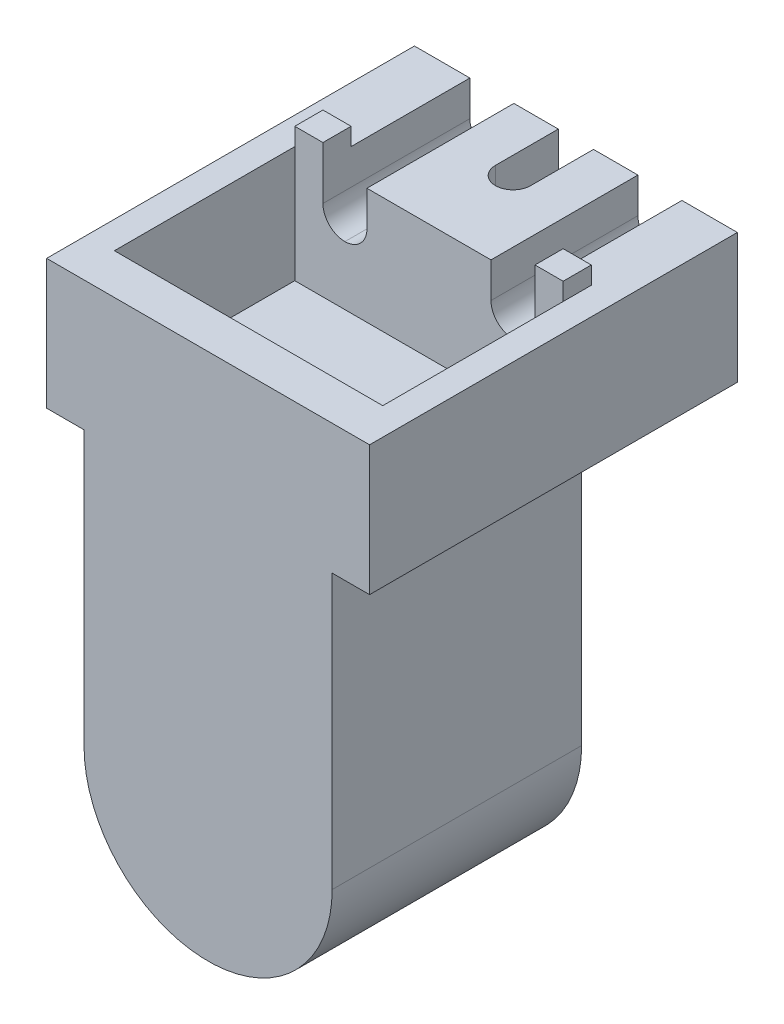
from build123d import *

# Parameters (mm, degrees)
RESSALTO_EXTRUS_O1_DEPTH = 28.35
ESBO_O2_R                = 4.25
CORTE_EXTRUS_O1_DEPTH    = 26
ESBO_O3_W                = 36.7
ESBO_O3_H                = 41.8
RESSALTO_EXTRUS_O2_DEPTH = 14.75
ESBO_O5_W                = 30.5
ESBO_O5_H                = 20.5
CORTE_EXTRUS_O2_DEPTH    = 13.2
CORTE_EXTRUS_O3_DEPTH    = 69.850889609
ESBO_O7_W                = 5
ESBO_O7_H                = 16.7
CORTE_EXTRUS_O4_DEPTH    = 6.5
FILETE1_R                = 2.5
ESBO_O8_W                = 8.5
ESBO_O8_H                = 3.5
CORTE_EXTRUS_O5_DEPTH    = 14
ESBO_O9_W                = 3.2
ESBO_O9_H                = 3.2
RESSALTO_EXTRUS_O3_DEPTH = 2


with BuildPart() as part:
    # Esboço1 → Ressalto-extrusão1 (new body)
    with BuildSketch(Plane.XY):
        with BuildLine():
            Line((14.1, -8.525), (14.1, 22.625))
            Line((14.1, 22.625), (-14.1, 22.625))
            Line((-14.1, 22.625), (-14.1, -8.525))
            ThreePointArc((-14.1, -8.525), (0, -22.625), (14.1, -8.525))
        make_face()
    extrude(amount=RESSALTO_EXTRUS_O1_DEPTH)

    # Esboço2 → Corte-extrusão1 (cut)
    with BuildSketch(Plane(origin=(0, 0, 0), x_dir=(-1, 0, 0), z_dir=(0, 0, -1))):
        with Locations((0, -13.375)):
            Circle(ESBO_O2_R)
    extrude(amount=-CORTE_EXTRUS_O1_DEPTH, mode=Mode.SUBTRACT)

    # Esboço3 → Ressalto-extrusão2 (add)
    with BuildSketch(Plane(origin=(0, 22.625, 0), x_dir=(1, 0, 0), z_dir=(0, 1, 0))):
        with Locations((0, -7.45)):
            Rectangle(ESBO_O3_W, ESBO_O3_H)
    extrude(amount=RESSALTO_EXTRUS_O2_DEPTH)

    # Esboço5 → Corte-extrusão2 (cut)
    with BuildSketch(Plane(origin=(0, 37.375, 0), x_dir=(1, 0, 0), z_dir=(0, 1, 0))):
        with Locations((0, -13.5)):
            Rectangle(ESBO_O5_W, ESBO_O5_H)
    extrude(amount=-CORTE_EXTRUS_O2_DEPTH, mode=Mode.SUBTRACT)

    # Esboço6 → Corte-extrusão3 (cut, through all)
    with BuildSketch(Plane(origin=(0, 37.375, 0), x_dir=(1, 0, 0), z_dir=(0, 1, 0))):
        with BuildLine():
            Line((-2, 13.45), (-2, 6.30835312))
            ThreePointArc((-2, 6.30835312), (0, 4.30835312), (2, 6.30835312))
            Line((2, 6.30835312), (2, 13.45))
            Line((2, 13.45), (-2, 13.45))
        make_face()
    extrude(amount=-CORTE_EXTRUS_O3_DEPTH, mode=Mode.SUBTRACT)

    # Esboço7 → Corte-extrusão4 (cut)
    with BuildSketch(Plane(origin=(0, 37.375, 0), x_dir=(1, 0, 0), z_dir=(0, 1, 0))):
        with Locations((-9.55, 5.1)):
            Rectangle(ESBO_O7_W, ESBO_O7_H)
        with Locations((9.55, 5.1)):
            Rectangle(ESBO_O7_W, ESBO_O7_H)
    extrude(amount=-CORTE_EXTRUS_O4_DEPTH, mode=Mode.SUBTRACT)

    # Filete1
    filete1_edges = [part.edges().sort_by_distance(p)[0] for p in [
        (-12.05, 30.875, -5.1),
        (-7.05, 30.875, -5.1),
        (7.05, 30.875, -5.1),
        (12.05, 30.875, -5.1),
    ]]
    fillet(filete1_edges, radius=FILETE1_R - 0.0001)  # a hair under: the kernel refuses the full size

    # Esboço8 → Corte-extrusão5 (cut)
    with BuildSketch(Plane(origin=(0, 0, -13.45), x_dir=(-1, 0, 0), z_dir=(0, 0, -1))):
        with Locations((0.04245602, 30)):
            Rectangle(ESBO_O8_W, ESBO_O8_H)
    extrude(amount=-CORTE_EXTRUS_O5_DEPTH, mode=Mode.SUBTRACT)

    # Esboço9 → Ressalto-extrusão3 (add)
    with BuildSketch(Plane(origin=(0, 37.375, 0), x_dir=(1, 0, 0), z_dir=(0, 1, 0))):
        with Locations((-13.65, -1.65)):
            Rectangle(ESBO_O9_W, ESBO_O9_H)
        with Locations((13.65, -1.65)):
            Rectangle(ESBO_O9_W, ESBO_O9_H)
    extrude(amount=RESSALTO_EXTRUS_O3_DEPTH)


solid = part.part
